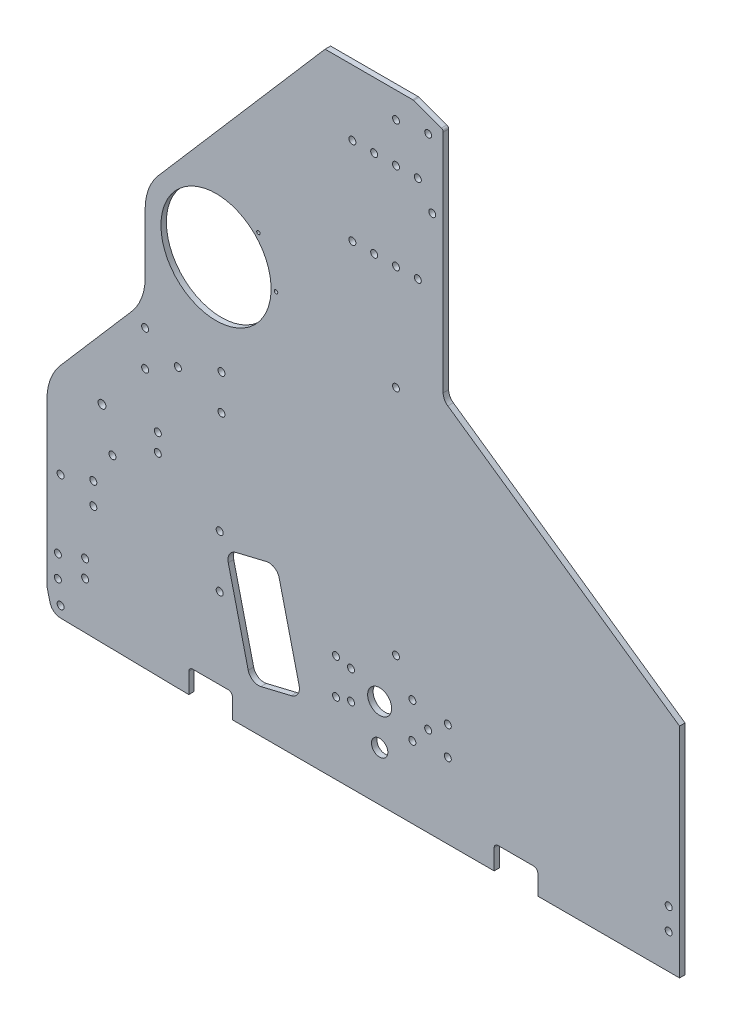
from build123d import *

# Parameters (mm, degrees)
SKETCH1_R           = 2.032
SKETCH1_R_2         = 2
BOSS_EXTRUDE1_DEPTH = 3.175
FILLET1_R           = 2.286
FILLET2_R           = 6.35
SKETCH2_R           = 2.032
CUT_EXTRUDE1_DEPTH  = 505.524983177
FILLET3_R           = 1.5875
SKETCH3_R           = 2.032
SKETCH3_R_2         = 2.286000003
SKETCH3_R_3         = 1.016
CUT_EXTRUDE2_DEPTH  = 505.524983177
SKETCH4_R           = 2.032
SKETCH4_R_2         = 6.985
SKETCH4_R_3         = 4.7625
CUT_EXTRUDE3_DEPTH  = 505.524983177
SKETCH5_R           = 32.0675
CUT_EXTRUDE5_DEPTH  = 540.282512256
FILLET4_R           = 31.75
SKETCH7_R           = 2.032
CUT_EXTRUDE6_DEPTH  = 505.524983177


with BuildPart() as part:
    # Sketch1 → Boss-Extrude1 (new body)
    with BuildSketch(Plane.XY):
        with BuildLine():
            Line((7.829508682, -19.049081656), (82.55, -20.32))
            Line((82.55, -20.32), (82.55, -6.35))
            Line((82.55, -6.35), (107.95, -6.35))
            Line((107.95, -6.35), (107.95, -20.32))
            Line((107.95, -20.32), (260.35, -20.32))
            Line((260.35, -20.32), (260.35, -6.35))
            Line((260.35, -6.35), (285.75, -6.35))
            Line((285.75, -6.35), (285.75, -20.32))
            Line((285.75, -20.32), (368.3, -20.32))
            Line((368.3, -20.32), (368.3, 106.68))
            Line((368.3, 106.68), (230.66375, 202.565))
            Line((230.66375, 202.565), (230.66375, 338.455))
            Line((230.66375, 338.455), (213.19998, 344.805))
            Line((213.19998, 344.805), (203.2, 344.805))
            Line((203.2, 344.805), (161.925, 344.805))
            Line((161.925, 344.805), (52.720122664, 218.469945827))
            ThreePointArc((52.720122664, 218.469945827), (52.803835479, 218.142145922), (52.832, 217.805))
            ThreePointArc((52.832, 217.805), (52.095493096, 216.239521914), (50.419872403, 215.808871996))
            Line((50.419872403, 215.808871996), (0, 157.48))
            Line((0, 157.48), (0, 0))
            Line((0, 0), (0, -6.35))
            ThreePointArc((0, -6.35), (0.047577015, -7.125863724), (0.189595124, -7.890101219))
            Line((0.189595124, -7.890101219), (1.777095124, -14.240101219))
            ThreePointArc((1.777095124, -14.240101219), (3.987212552, -17.671692778), (7.829508682, -19.049081656))
        make_face()
        with Locations((7.9375, -12.7)):
            Circle(SKETCH1_R, mode=Mode.SUBTRACT)
        with Locations((6.35, 0)):
            Circle(SKETCH1_R, mode=Mode.SUBTRACT)
        with Locations((6.35, 12.7)):
            Circle(SKETCH1_R, mode=Mode.SUBTRACT)
        with Locations((38.1, 78.105)):
            Circle(SKETCH1_R, mode=Mode.SUBTRACT)
        with Locations((57.15, 131.28625)):
            Circle(SKETCH1_R, mode=Mode.SUBTRACT)
        with Locations((57.15, 151.92375)):
            Circle(SKETCH1_R, mode=Mode.SUBTRACT)
        with Locations((76.2, 141.605)):
            Circle(SKETCH1_R, mode=Mode.SUBTRACT)
        with Locations((101.6, 131.28625)):
            Circle(SKETCH1_R, mode=Mode.SUBTRACT)
        with Locations((101.6, 151.92375)):
            Circle(SKETCH1_R, mode=Mode.SUBTRACT)
        with Locations((203.2, 59.805)):
            Circle(SKETCH1_R_2, mode=Mode.SUBTRACT)
        with Locations((361.95, 0)):
            Circle(SKETCH1_R, mode=Mode.SUBTRACT)
        with Locations((361.95, 12.7)):
            Circle(SKETCH1_R, mode=Mode.SUBTRACT)
        with Locations((76.2, 217.805)):
            Circle(SKETCH1_R, mode=Mode.SUBTRACT)
        with Locations((203.2, 194.805)):
            Circle(SKETCH1_R_2, mode=Mode.SUBTRACT)
        with Locations((224.31375, 293.243)):
            Circle(SKETCH1_R, mode=Mode.SUBTRACT)
        with Locations((203.2, 329.805)):
            Circle(SKETCH1_R_2, mode=Mode.SUBTRACT)
        with Locations((221.931865, 332.105)):
            Circle(SKETCH1_R_2, mode=Mode.SUBTRACT)
    extrude(amount=BOSS_EXTRUDE1_DEPTH)

    # Fillet1
    fillet1_edges = [part.edges().sort_by_distance(p)[0] for p in [
        (285.75, -6.35, 1.5875),
        (107.95, -6.35, 1.5875),
        (260.35, -6.35, 1.5875),
        (82.55, -6.35, 1.5875),
    ]]
    fillet(fillet1_edges, radius=FILLET1_R)

    # Fillet2
    fillet2_edges = [part.edges().sort_by_distance(p)[0] for p in [
        (230.66375, 202.565, 1.5875),
    ]]
    fillet(fillet2_edges, radius=FILLET2_R)

    # Sketch2 → Cut-Extrude1 (cut, through all)
    with BuildSketch(Plane(origin=(0, 0, 0), x_dir=(-1, 0, 0), z_dir=(0, 0, -1))):
        with Locations((-100.552770272, 71.086035298)):
            Circle(SKETCH2_R)
        with Locations((-100.552770272, 40.606035298)):
            Circle(SKETCH2_R)
        with Locations((-22.225, 18.202541089)):
            Circle(SKETCH2_R)
        with Locations((-22.225, 8.042541089)):
            Circle(SKETCH2_R)
    extrude(amount=-CUT_EXTRUDE1_DEPTH, mode=Mode.SUBTRACT)

    # Fillet3
    fillet3_edges = [part.edges().sort_by_distance(p)[0] for p in [
        (230.66375, 338.455, 1.5875),
        (213.19998, 344.805, 1.5875),
    ]]
    fillet(fillet3_edges, radius=FILLET3_R)

    # Sketch3 → Cut-Extrude2 (cut, through all)
    with BuildSketch(Plane.XY.offset(3.175)):
        with BuildLine():
            Line((127.789350204, 69.359774106), (110.090750333, 65.117184968))
            ThreePointArc((110.090750333, 65.117184968), (106.287939849, 62.356288953), (105.551195063, 57.715047577))
            Line((105.551195063, 57.715047577), (117.160037868, 9.287010566))
            ThreePointArc((117.160037868, 9.287010566), (119.920933884, 5.484200083), (124.562175259, 4.747455297))
            Line((124.562175259, 4.747455297), (142.260775131, 8.990044434))
            ThreePointArc((142.260775131, 8.990044434), (146.063585615, 11.75094045), (146.8003304, 16.392181825))
            Line((146.8003304, 16.392181825), (135.191487595, 64.820218836))
            ThreePointArc((135.191487595, 64.820218836), (132.43059158, 68.62302932), (127.789350204, 69.359774106))
        make_face()
        with Locations((26.987500002, 46.953113935)):
            Circle(SKETCH3_R)
        with Locations((26.987500002, 59.653113935)):
            Circle(SKETCH3_R)
        with Locations((7.937500002, 53.303113935)):
            Circle(SKETCH3_R)
        with Locations((32.030600734, 100.810868777)):
            Circle(SKETCH3_R_2)
        with Locations((64.525942114, 102.94048958)):
            Circle(SKETCH3_R)
        with Locations((64.525942114, 92.525786339)):
            Circle(SKETCH3_R)
        with Locations((133.35, 208.228121768)):
            Circle(SKETCH3_R_3)
        with Locations((123.120704333, 232.923826101)):
            Circle(SKETCH3_R_3)
    extrude(amount=-CUT_EXTRUDE2_DEPTH, mode=Mode.SUBTRACT)

    # Sketch4 → Cut-Extrude3 (cut, through all)
    with BuildSketch(Plane.XY.offset(3.175)):
        with Locations((168.275, 42.06875)):
            Circle(SKETCH4_R)
        with Locations((212.725, 42.06875)):
            Circle(SKETCH4_R)
        with Locations((212.725, 21.43125)):
            Circle(SKETCH4_R)
        with Locations((168.275, 21.43125)):
            Circle(SKETCH4_R)
        with Locations((193.675, 31.75)):
            Circle(SKETCH4_R_2)
        with Locations((177.00498, 40.0431)):
            Circle(SKETCH4_R)
        with Locations((177.00498, 23.4569)):
            Circle(SKETCH4_R)
        with Locations((193.675, 8.466666658)):
            Circle(SKETCH4_R_3)
        with Locations((221.931865, 31.75)):
            Circle(SKETCH4_R)
        with Locations((233.36123, 23.4569)):
            Circle(SKETCH4_R)
        with Locations((233.36123, 40.0431)):
            Circle(SKETCH4_R)
    extrude(amount=-CUT_EXTRUDE3_DEPTH, mode=Mode.SUBTRACT)

    # Sketch5 → Cut-Extrude5 (cut, through all)
    with BuildSketch(Plane(origin=(0, 0, -187.325), x_dir=(-1, 0, 0), z_dir=(0, 0, -1))):
        Polygon((0, 157.48), (-57.15, 223.594705882), (-57.15, 165.333696112), (0, 99.218990229), align=None)
        with Locations((-98.425, 208.228121768)):
            Circle(SKETCH5_R)
    extrude(amount=-CUT_EXTRUDE5_DEPTH, mode=Mode.SUBTRACT)

    # Fillet4
    fillet4_edges = [part.edges().sort_by_distance(p)[0] for p in [
        (0, 99.218990229, 1.5875),
        (57.15, 165.333696112, 1.5875),
        (57.15, 223.594705882, 1.5875),
    ]]
    fillet(fillet4_edges, radius=FILLET4_R)

    # Sketch7 → Cut-Extrude6 (cut, through all)
    with BuildSketch(Plane(origin=(0, 0, 0), x_dir=(-1, 0, 0), z_dir=(0, 0, -1))):
        with Locations((-215.899995712, 306.704996637)):
            Circle(SKETCH7_R)
        with Locations((-203.199995712, 306.704996637)):
            Circle(SKETCH7_R)
        with Locations((-177.799995712, 306.704996732)):
            Circle(SKETCH7_R)
        with Locations((-190.499995712, 306.704996732)):
            Circle(SKETCH7_R)
        with Locations((-215.899995712, 255.904996637)):
            Circle(SKETCH7_R)
        with Locations((-203.199995712, 255.904996637)):
            Circle(SKETCH7_R)
        with Locations((-190.499995712, 255.904996732)):
            Circle(SKETCH7_R)
        with Locations((-177.799995712, 255.904996732)):
            Circle(SKETCH7_R)
    extrude(amount=-CUT_EXTRUDE6_DEPTH, mode=Mode.SUBTRACT)


solid = part.part
